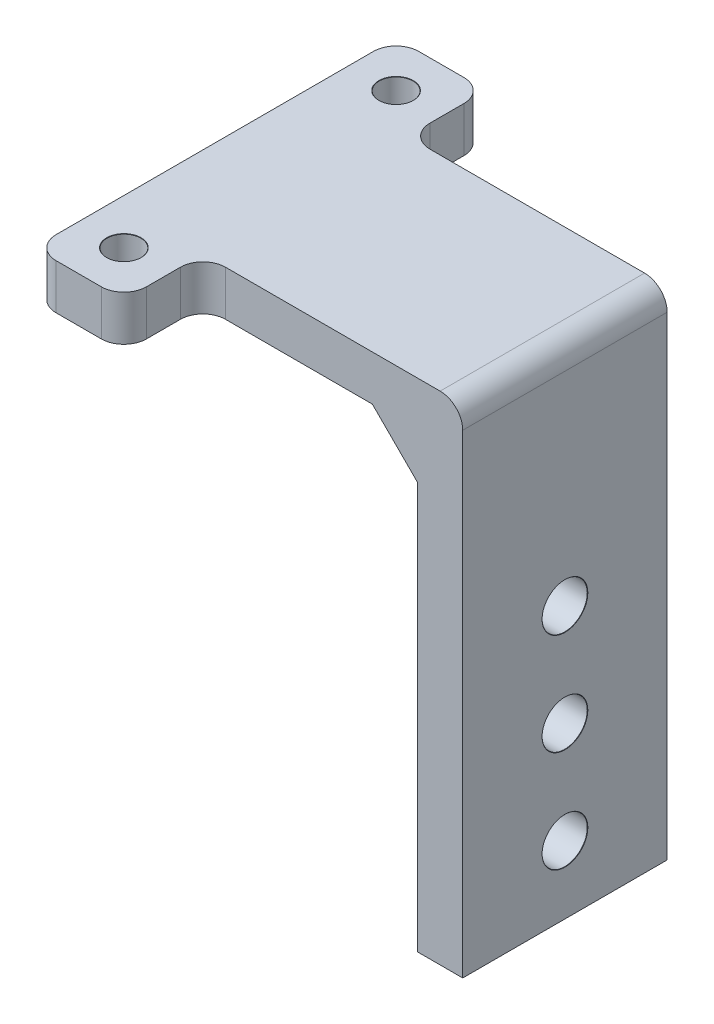
from build123d import *

# Parameters (mm, degrees)
BOSS_EXTRUDE1_DEPTH             = 4
FILLET1_R                       = 2
F_3_0MM_DOWEL_HOLE1_D           = 3
F_3_0MM_DOWEL_HOLE1_CSINK_D     = 3.05
F_3_0MM_DOWEL_HOLE1_CSINK_ANGLE = 90
SKETCH4_W                       = 4
SKETCH4_H                       = 18.1
BOSS_EXTRUDE2_DEPTH             = 40
CHAMFER1_SIZE                   = 4
FILLET2_R                       = 2
F_4_0MM_DOWEL_HOLE1_D           = 4
F_4_0MM_DOWEL_HOLE1_CSINK_D     = 4.05
F_4_0MM_DOWEL_HOLE1_CSINK_ANGLE = 90


with BuildPart() as part:
    # Sketch1 → Boss-Extrude1 (new body)
    with BuildSketch(Plane(origin=(0, 0, 0), x_dir=(1, 0, 0), z_dir=(0, 1, 0))):
        Polygon((0, 16.05), (0, -16.05), (8, -16.05), (8, -9.05), (31, -9.05), (31, 9.05), (8, 9.05), (8, 16.05), align=None)
    extrude(amount=BOSS_EXTRUDE1_DEPTH)

    # Fillet1
    fillet1_edges = [part.edges().sort_by_distance(p)[0] for p in [
        (0, 2, -16.05),
        (8, 2, -9.05),
        (8, 2, -16.05),
        (0, 2, 16.05),
        (8, 2, 16.05),
        (8, 2, 9.05),
    ]]
    fillet(fillet1_edges, radius=FILLET1_R)

    # Ø3.0mm Dowel Hole1 (through all)
    with Locations(Plane(origin=(0, 4, 0), x_dir=(1, 0, 0), z_dir=(0, 1, 0))):
        with Locations((4, 12.05), (4, -12.05)):
            CounterSinkHole(F_3_0MM_DOWEL_HOLE1_D / 2, F_3_0MM_DOWEL_HOLE1_CSINK_D / 2, counter_sink_angle=F_3_0MM_DOWEL_HOLE1_CSINK_ANGLE)

    # Sketch4 → Boss-Extrude2 (add)
    with BuildSketch(Plane(origin=(0, 0, 0), x_dir=(-1, 0, 0), z_dir=(0, -1, 0))):
        with Locations((-29, 0)):
            Rectangle(SKETCH4_W, SKETCH4_H)
    extrude(amount=BOSS_EXTRUDE2_DEPTH)

    # Chamfer1
    chamfer1_edges = [part.edges().sort_by_distance(p)[0] for p in [
        (27, 0, 0),
    ]]
    chamfer(chamfer1_edges, length=CHAMFER1_SIZE)

    # Fillet2
    fillet2_edges = [part.edges().sort_by_distance(p)[0] for p in [
        (31, 4, 0),
    ]]
    fillet(fillet2_edges, radius=FILLET2_R)

    # Ø4.0mm Dowel Hole1 (through all)
    with Locations(Plane(origin=(31, 0, 0), x_dir=(0, 0, -1), z_dir=(1, 0, 0))):
        with Locations((0, -34), (0, -25), (0, -16)):
            CounterSinkHole(F_4_0MM_DOWEL_HOLE1_D / 2, F_4_0MM_DOWEL_HOLE1_CSINK_D / 2, counter_sink_angle=F_4_0MM_DOWEL_HOLE1_CSINK_ANGLE)


solid = part.part
